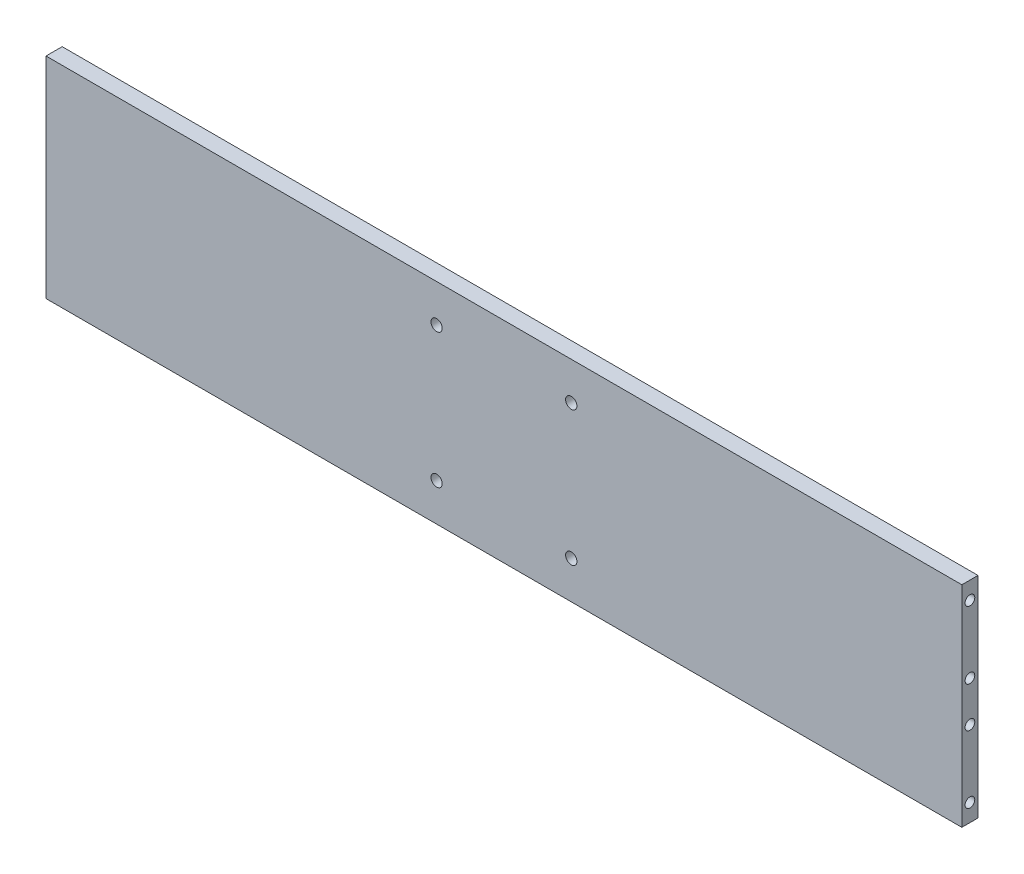
from build123d import *

# Parameters (mm, degrees)
SKETCH1_W           = 340
SKETCH1_H           = 78
SKETCH1_R           = 2.1
BOSS_EXTRUDE1_DEPTH = 6
CUT_EXTRUDE1_REACH  = 344.282
SKETCH2_R           = 1.8


with BuildPart() as part:
    # Sketch1 → Boss-Extrude1 (new body)
    with BuildSketch(Plane.XY):
        Rectangle(SKETCH1_W, SKETCH1_H)
        with Locations((-25, 25)):
            Circle(SKETCH1_R, mode=Mode.SUBTRACT)
        with Locations((25, 25)):
            Circle(SKETCH1_R, mode=Mode.SUBTRACT)
        with Locations((25, -25)):
            Circle(SKETCH1_R, mode=Mode.SUBTRACT)
        with Locations((-25, -25)):
            Circle(SKETCH1_R, mode=Mode.SUBTRACT)
    extrude(amount=BOSS_EXTRUDE1_DEPTH)

    # Sketch2 → Cut-Extrude1 (cut, up to next)
    with BuildSketch(Plane(origin=(170, 0, 0), x_dir=(0, 0, -1), z_dir=(1, 0, 0)), mode=Mode.PRIVATE) as cut_extrude1_sk1:
        with Locations((-3, 32.5)):
            Circle(SKETCH2_R)
    cut_extrude1_tool1 = extrude(cut_extrude1_sk1.sketch, amount=-CUT_EXTRUDE1_REACH, mode=Mode.PRIVATE) & part.part
    # Sketch2 → Cut-Extrude1 (cut, up to next)
    with BuildSketch(Plane(origin=(170, 0, 0), x_dir=(0, 0, -1), z_dir=(1, 0, 0)), mode=Mode.PRIVATE) as cut_extrude1_sk2:
        with Locations((-3, 7.5)):
            Circle(SKETCH2_R)
    cut_extrude1_tool2 = extrude(cut_extrude1_sk2.sketch, amount=-CUT_EXTRUDE1_REACH, mode=Mode.PRIVATE) & part.part
    # Sketch2 → Cut-Extrude1 (cut, up to next)
    with BuildSketch(Plane(origin=(170, 0, 0), x_dir=(0, 0, -1), z_dir=(1, 0, 0)), mode=Mode.PRIVATE) as cut_extrude1_sk3:
        with Locations((-3, -7.5)):
            Circle(SKETCH2_R)
    cut_extrude1_tool3 = extrude(cut_extrude1_sk3.sketch, amount=-CUT_EXTRUDE1_REACH, mode=Mode.PRIVATE) & part.part
    # Sketch2 → Cut-Extrude1 (cut, up to next)
    with BuildSketch(Plane(origin=(170, 0, 0), x_dir=(0, 0, -1), z_dir=(1, 0, 0)), mode=Mode.PRIVATE) as cut_extrude1_sk4:
        with Locations((-3, -32.5)):
            Circle(SKETCH2_R)
    cut_extrude1_tool4 = extrude(cut_extrude1_sk4.sketch, amount=-CUT_EXTRUDE1_REACH, mode=Mode.PRIVATE) & part.part
    add(cut_extrude1_tool1.solids().sort_by_distance((170, 32.5, 3))[0], mode=Mode.SUBTRACT)
    add(cut_extrude1_tool2.solids().sort_by_distance((170, 7.5, 3))[0], mode=Mode.SUBTRACT)
    add(cut_extrude1_tool3.solids().sort_by_distance((170, -7.5, 3))[0], mode=Mode.SUBTRACT)
    add(cut_extrude1_tool4.solids().sort_by_distance((170, -32.5, 3))[0], mode=Mode.SUBTRACT)


solid = part.part
